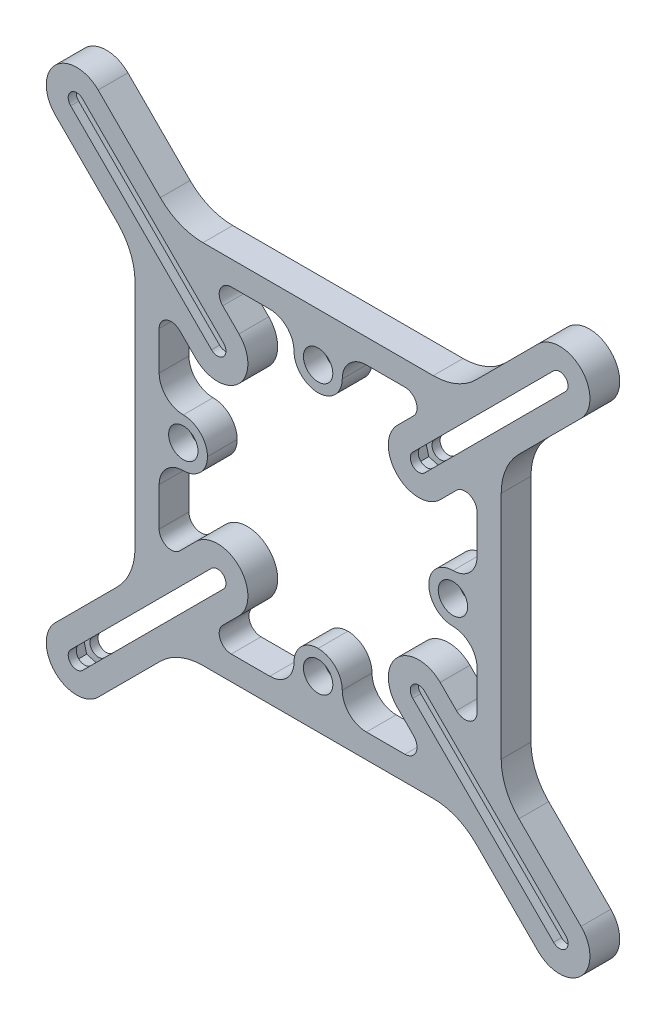
from build123d import *

# Parameters (mm, degrees)
EXTRUDE_1_DEPTH                           = 1.7
CUT_EXTRUDE_4_DEPTH                       = 96.590611464
EXTRUDE_START                             = 2
EXTRUDE_3_DEPTH                           = 2
MIRROR_6_ANGLE                            = 180
EXTRUDE_START_2                           = -3.7
SKETCH_2_W                                = 91
SKETCH_2_H                                = 91
SKETCH_2_W_2                              = 79
SKETCH_2_H_2                              = 79
EXTRUDE_4_DEPTH                           = 7.4
CUT_EXTRUDE_5_DEPTH                       = 3.4
CUT_EXTRUDE_6_DEPTH                       = 96.816308633
MIRROR_7_AT_THE_SECOND_PLANE_COPY_1_DEPTH = 3.4
MIRROR_7_AT_THE_SECOND_PLANE_COPY_2_DEPTH = 96.816308633
SKETCH_37_W                               = 12
SKETCH_37_H                               = 12
SKETCH_37_R                               = 2.15
EXTRUDE_5_DEPTH                           = 7.4
SKETCH_38_R                               = 3.65
CUT_EXTRUDE_7_DEPTH                       = 5
PATTERN_CIRCULAR_1_COUNT                  = 4
FILLET_1_R                                = 15
FILLET_2_R                                = 3
FILLET_START                              = -5
FILLET_3_DEPTH                            = 10
FILLET_START_2                            = -3.7
FILLET_3_2_DEPTH                          = 7.4


with BuildPart() as part:
    # ｽｹｯﾁ1 → ﾎﾞｽ - 押し出し1 (new, symmetric)
    with BuildSketch(Plane.XY):
        with BuildLine():
            Line((30.338656198, -19.661343802), (65.338656198, -54.661343802))
            ThreePointArc((65.338656198, -54.661343802), (65.338656198, -65.338656198), (54.661343802, -65.338656198))
            Line((54.661343802, -65.338656198), (19.661343802, -30.338656198))
            ThreePointArc((19.661343802, -30.338656198), (19.661343802, -19.661343802), (30.338656198, -19.661343802))
        make_face()
        with BuildLine():
            Line((27.510229073, -22.489770927), (62.510229073, -57.489770927))
            ThreePointArc((62.510229073, -57.489770927), (62.510229073, -62.510229073), (57.489770927, -62.510229073))
            Line((57.489770927, -62.510229073), (22.489770927, -27.510229073))
            ThreePointArc((22.489770927, -27.510229073), (22.489770927, -22.489770927), (27.510229073, -22.489770927))
        make_face(mode=Mode.SUBTRACT)
    extrude(amount=EXTRUDE_1_DEPTH, both=True)

    # ｽｹｯﾁ8 → ｶｯﾄ - 押し出し4 (cut, through all)
    with BuildSketch(Plane.XY.offset(1.7)):
        Polygon((23.939052358, -28.959510504), (27.898562862, -27.898562862), (28.959510504, -23.939052358), (26.060947642, -21.040489496), (22.101437138, -22.101437138), (21.040489496, -26.060947642), align=None)
        Polygon((58.939052358, -63.959510504), (62.898562862, -62.898562862), (63.959510504, -58.939052358), (61.060947642, -56.040489496), (57.101437138, -57.101437138), (56.040489496, -61.060947642), align=None)
    extrude(amount=-CUT_EXTRUDE_4_DEPTH, mode=Mode.SUBTRACT)

    # ｽｹｯﾁ6 → ﾎﾞｽ - 押し出し3 (add)
    with BuildSketch(Plane.XY.offset(1.7).offset(EXTRUDE_START)):
        with BuildLine():
            Line((65.338656198, -54.661343802), (30.338656198, -19.661343802))
            ThreePointArc((30.338656198, -19.661343802), (19.661343802, -19.661343802), (19.661343802, -30.338656198))
            Line((19.661343802, -30.338656198), (54.661343802, -65.338656198))
            ThreePointArc((54.661343802, -65.338656198), (65.338656198, -65.338656198), (65.338656198, -54.661343802))
        make_face()
        with BuildLine():
            Line((26.48492424, -23.51507576), (61.48492424, -58.51507576))
            ThreePointArc((61.48492424, -58.51507576), (61.48492424, -61.48492424), (58.51507576, -61.48492424))
            Line((58.51507576, -61.48492424), (23.51507576, -26.48492424))
            ThreePointArc((23.51507576, -26.48492424), (23.51507576, -23.51507576), (26.48492424, -23.51507576))
        make_face(mode=Mode.SUBTRACT)
    extrude_3 = extrude(amount=-EXTRUDE_3_DEPTH)

    # ﾐﾗｰ5: ﾎﾞｽ - 押し出し3 across plane
    add(extrude_3.mirror(Plane.XY))


with BuildPart() as body_2:
    # ﾐﾗｰ6: read off the stored shape, not the designer's step
    # ﾐﾗｰ6: copy of part
    add(part.part.rotate(Axis((0, 0, 0), (0, 0, 1)), MIRROR_6_ANGLE))


with BuildPart() as body_3:
    # Mirror 6 2: mirrored copy
    add(part.part.mirror(Plane(origin=(0, 0, 0), x_dir=(1, 0, 0), z_dir=(0, 1, 0))))


with BuildPart() as body_4:
    # Mirror 6 3: mirrored copy
    add(part.part.mirror(Plane.YZ))


with BuildPart() as part_1:
    add(part.part)

    add(body_2.part)  # ﾎﾞｽ - 押し出し4 merges body 2

    add(body_3.part)  # ﾎﾞｽ - 押し出し4 merges body 3

    add(body_4.part)  # ﾎﾞｽ - 押し出し4 merges body 4
    # ｽｹｯﾁ2 → ﾎﾞｽ - 押し出し4 (add)
    with BuildSketch(Plane.XY.offset(EXTRUDE_START_2)):
        Rectangle(SKETCH_2_W, SKETCH_2_H)
        Rectangle(SKETCH_2_W_2, SKETCH_2_H_2, mode=Mode.SUBTRACT)
    extrude(amount=EXTRUDE_4_DEPTH)

    # ｽｹｯﾁ9 → ｶｯﾄ - 押し出し5 (cut)
    with BuildSketch(Plane.XY.offset(-1.7)):
        Polygon((21.040489496, -26.060947642), (22.101437138, -22.101437138), (26.060947642, -21.040489496), (63.959510504, -58.939052358), (62.898562862, -62.898562862), (58.939052358, -63.959510504), align=None)
    cut_extrude_5 = extrude(amount=CUT_EXTRUDE_5_DEPTH, mode=Mode.SUBTRACT)

    # ｽｹｯﾁ10 → ｶｯﾄ - 押し出し6 (cut, through all)
    with BuildSketch(Plane.XY.offset(3.7)):
        with BuildLine():
            Line((26.48492424, -23.51507576), (61.48492424, -58.51507576))
            ThreePointArc((61.48492424, -58.51507576), (61.48492424, -61.48492424), (58.51507576, -61.48492424))
            Line((58.51507576, -61.48492424), (23.51507576, -26.48492424))
            ThreePointArc((23.51507576, -26.48492424), (23.51507576, -23.51507576), (26.48492424, -23.51507576))
        make_face()
    cut_extrude_6 = extrude(amount=-CUT_EXTRUDE_6_DEPTH, mode=Mode.SUBTRACT)

    # ﾐﾗｰ7: ｶｯﾄ - 押し出し5, ｶｯﾄ - 押し出し6 across plane
    add(cut_extrude_5.mirror(Plane(origin=(0, 0, 0), x_dir=(0, 0, 1), z_dir=(1, 0, 0))), mode=Mode.SUBTRACT)
    add(cut_extrude_6.mirror(Plane(origin=(0, 0, 0), x_dir=(0, 0, 1), z_dir=(1, 0, 0))), mode=Mode.SUBTRACT)

    # ﾐﾗｰ7 at the second plane: ｶｯﾄ - 押し出し5, ｶｯﾄ - 押し出し6 across plane
    add(cut_extrude_5.mirror(Plane.ZX), mode=Mode.SUBTRACT)
    add(cut_extrude_6.mirror(Plane.ZX), mode=Mode.SUBTRACT)

    # ﾐﾗｰ7 at the second plane copy 1 sket → ﾐﾗｰ7 at the second plane copy 1 (cut)
    with BuildSketch(Plane(origin=(0, 0, -1.7), x_dir=(-1, 0, 0), z_dir=(0, 0, 1))):
        Polygon((21.040489496, -26.060947642), (22.101437138, -22.101437138), (26.060947642, -21.040489496), (63.959510504, -58.939052358), (62.898562862, -62.898562862), (58.939052358, -63.959510504), align=None)
    extrude(amount=MIRROR_7_AT_THE_SECOND_PLANE_COPY_1_DEPTH, mode=Mode.SUBTRACT)

    # ﾐﾗｰ7 at the second plane copy 2 sket → ﾐﾗｰ7 at the second plane copy 2 (cut, through all)
    with BuildSketch(Plane(origin=(0, 0, 3.7), x_dir=(-1, 0, 0), z_dir=(0, 0, 1))):
        with BuildLine():
            Line((26.48492424, -23.51507576), (61.48492424, -58.51507576))
            ThreePointArc((61.48492424, -58.51507576), (61.48492424, -61.48492424), (58.51507576, -61.48492424))
            Line((58.51507576, -61.48492424), (23.51507576, -26.48492424))
            ThreePointArc((23.51507576, -26.48492424), (23.51507576, -23.51507576), (26.48492424, -23.51507576))
        make_face()
    extrude(amount=-MIRROR_7_AT_THE_SECOND_PLANE_COPY_2_DEPTH, mode=Mode.SUBTRACT)

    # ｽｹｯﾁ37 → ﾎﾞｽ - 押し出し5 (add)
    with BuildSketch(Plane.XY.offset(3.7)):
        with Locations((-33.5, 0)):
            Rectangle(SKETCH_37_W, SKETCH_37_H)
        with Locations((-33.5, 0)):
            Circle(SKETCH_37_R, mode=Mode.SUBTRACT)
    extrude_5 = extrude(amount=-EXTRUDE_5_DEPTH)

    # ｽｹｯﾁ38 → ｶｯﾄ - 押し出し7 (cut)
    with BuildSketch(Plane.XY.offset(3.7)):
        with Locations((-33.5, 0)):
            Circle(SKETCH_38_R)
    cut_extrude_7 = extrude(amount=-CUT_EXTRUDE_7_DEPTH, mode=Mode.SUBTRACT)

    # 円形ﾊﾟﾀｰﾝ1: ﾎﾞｽ - 押し出し5, ｶｯﾄ - 押し出し7 ×4 about axis
    pattern_circular_1_axis = Axis((0, 0, 0), (0, 0, 1))
    add([extrude_5.rotate(pattern_circular_1_axis, i * 360 / PATTERN_CIRCULAR_1_COUNT) for i in range(1, PATTERN_CIRCULAR_1_COUNT)])
    add([cut_extrude_7.rotate(pattern_circular_1_axis, i * 360 / PATTERN_CIRCULAR_1_COUNT) for i in range(1, PATTERN_CIRCULAR_1_COUNT)], mode=Mode.SUBTRACT)

    # ﾌｨﾚｯﾄ1
    fillet_1_edges = [part_1.edges().sort_by_distance(p)[0] for p in [
        (45.5, -34.822687604, 0),
        (34.822687604, -45.5, 0),
        (-34.822687604, -45.5, 0),
        (-45.5, -34.822687604, 0),
        (45.5, 34.822687604, 0),
        (34.822687604, 45.5, 0),
        (-34.822687604, 45.5, 0),
        (-45.5, 34.822687604, 0),
    ]]
    fillet(fillet_1_edges, radius=FILLET_1_R)

    # ﾌｨﾚｯﾄ2
    fillet_2_edges = [part_1.edges().sort_by_distance(p)[0] for p in [
        (39.5, -28.822687604, 0),
        (28.822687604, -39.5, 0),
        (-39.5, -28.822687604, 0),
        (-28.822687604, -39.5, 0),
        (28.822687604, 39.5, 0),
        (39.5, 28.822687604, 0),
        (-28.822687604, 39.5, 0),
        (-39.5, 28.822687604, 0),
    ]]
    fillet(fillet_2_edges, radius=FILLET_2_R)

    # ﾌｨﾚｯﾄ3: read off the stored shape, not the designer's step
    # ﾌｨﾚｯﾄ3 outline → ﾌｨﾚｯﾄ3 (cut)
    with BuildSketch(Plane.XY.offset(FILLET_START)):
        with BuildLine():
            Line((27.5, -6), (33.5, -6))
            ThreePointArc((33.5, -6), (29.257359313, -4.242640687), (27.5, 0))
            Line((27.5, 0), (27.5, -6))
        make_face()
        with BuildLine():
            Line((27.5, 6), (27.5, 0))
            ThreePointArc((27.5, 0), (29.257359313, 4.242640687), (33.5, 6))
            Line((33.5, 6), (27.5, 6))
        make_face()
        with BuildLine():
            Line((-6, -27.5), (-6, -33.5))
            ThreePointArc((-6, -33.5), (-4.242640687, -29.257359313), (0, -27.5))
            Line((0, -27.5), (-6, -27.5))
        make_face()
        with BuildLine():
            Line((6, -27.5), (0, -27.5))
            ThreePointArc((0, -27.5), (4.242640687, -29.257359313), (6, -33.5))
            Line((6, -33.5), (6, -27.5))
        make_face()
        with BuildLine():
            ThreePointArc((-33.5, 6), (-29.257359313, 4.242640687), (-27.5, 0))
            Line((-27.5, 0), (-27.5, 6))
            Line((-27.5, 6), (-33.5, 6))
        make_face()
        with BuildLine():
            ThreePointArc((-27.5, 0), (-29.257359313, -4.242640687), (-33.5, -6))
            Line((-33.5, -6), (-27.5, -6))
            Line((-27.5, -6), (-27.5, 0))
        make_face()
        with BuildLine():
            Line((6, 27.5), (6, 33.5))
            ThreePointArc((6, 33.5), (4.242640687, 29.257359313), (0, 27.5))
            Line((0, 27.5), (6, 27.5))
        make_face()
        with BuildLine():
            Line((-6, 27.5), (0, 27.5))
            ThreePointArc((0, 27.5), (-4.242640687, 29.257359313), (-6, 33.5))
            Line((-6, 33.5), (-6, 27.5))
        make_face()
    extrude(amount=FILLET_3_DEPTH, mode=Mode.SUBTRACT)

    # Fillet 3 2 outline → Fillet 3 2 (add)
    with BuildSketch(Plane.XY.offset(FILLET_START_2)):
        with BuildLine():
            Line((39.5, -6), (33.5, -6))
            ThreePointArc((33.5, -6), (37.742640687, -7.757359313), (39.5, -12))
            Line((39.5, -12), (39.5, -6))
        make_face()
        with BuildLine():
            ThreePointArc((39.5, 12), (37.742640687, 7.757359313), (33.5, 6))
            Line((33.5, 6), (39.5, 6))
            Line((39.5, 6), (39.5, 12))
        make_face()
        with BuildLine():
            Line((-6, -39.5), (-6, -33.5))
            ThreePointArc((-6, -33.5), (-7.757359313, -37.742640687), (-12, -39.5))
            Line((-12, -39.5), (-6, -39.5))
        make_face()
        with BuildLine():
            ThreePointArc((12, -39.5), (7.757359313, -37.742640687), (6, -33.5))
            Line((6, -33.5), (6, -39.5))
            Line((6, -39.5), (12, -39.5))
        make_face()
        with BuildLine():
            Line((-39.5, -6), (-39.5, -12))
            ThreePointArc((-39.5, -12), (-37.742640687, -7.757359313), (-33.5, -6))
            Line((-33.5, -6), (-39.5, -6))
        make_face()
        with BuildLine():
            Line((-39.5, 6), (-33.5, 6))
            ThreePointArc((-33.5, 6), (-37.742640687, 7.757359313), (-39.5, 12))
            Line((-39.5, 12), (-39.5, 6))
        make_face()
        with BuildLine():
            Line((6, 39.5), (6, 33.5))
            ThreePointArc((6, 33.5), (7.757359313, 37.742640687), (12, 39.5))
            Line((12, 39.5), (6, 39.5))
        make_face()
        with BuildLine():
            ThreePointArc((-12, 39.5), (-7.757359313, 37.742640687), (-6, 33.5))
            Line((-6, 33.5), (-6, 39.5))
            Line((-6, 39.5), (-12, 39.5))
        make_face()
    extrude(amount=FILLET_3_2_DEPTH)


solid = part_1.part
